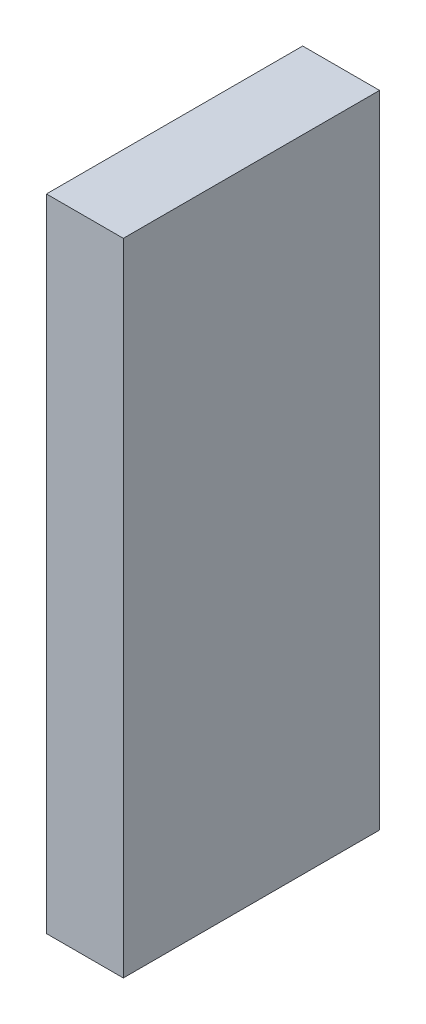
from build123d import *

# Parameters (mm, degrees)
SKETCH1_W           = 12
SKETCH1_H           = 40
BOSS_EXTRUDE1_DEPTH = 50


with BuildPart() as part:
    # Sketch1 → Boss-Extrude1 (new, symmetric)
    with BuildSketch(Plane(origin=(0, 0, 0), x_dir=(1, 0, 0), z_dir=(0, 1, 0))):
        Rectangle(SKETCH1_W, SKETCH1_H)
    extrude(amount=BOSS_EXTRUDE1_DEPTH, both=True)


solid = part.part
